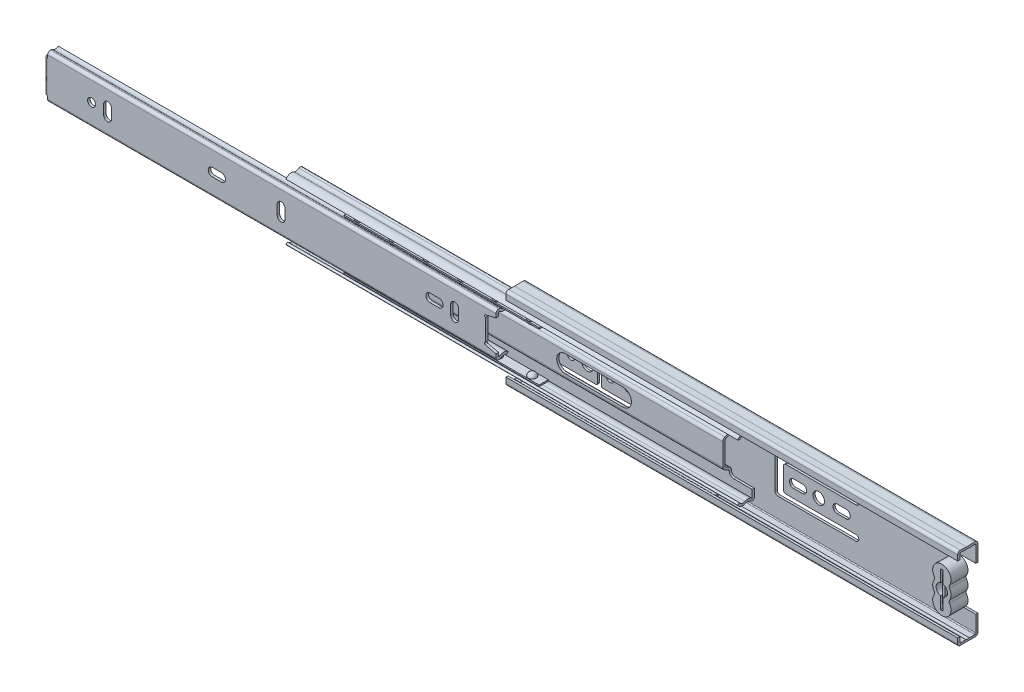
from build123d import *
from build123d.topology import SkipClean

# Parameters (mm, degrees)
EXTRUDE1_DEPTH      = 124.968
MIDDLE_MEMBER_DEPTH = 249.936
DRAWER_START        = -249.936
DRAWER_MEMBER_DEPTH = 249.936
SKETCH6_W           = 1.905
SKETCH6_H           = 12.147486483
CUT_EXTRUDE1_DEPTH  = 380.866876503
EXTRUDE4_DEPTH      = 8.89
CUT_EXTRUDE2_DEPTH  = 1.1938
SKETCH9_W           = 1.397
SKETCH9_H           = 7.493000005
EXTRUDE5_DEPTH      = 8.89
EXTRUDE6_DEPTH      = 1.016
EXTRUDE6_DEPTH_BACK = 8.382
CUT_EXTRUDE3_DEPTH  = 1.397
CUT_EXTRUDE4_DEPTH  = 380.716914371
CUT_EXTRUDE5_DEPTH  = 1.1938
CUT_EXTRUDE14_DEPTH = 1.1938
CUT_EXTRUDE15_DEPTH = 1.1938
SKETCH24_R          = 2.1844
CUT_EXTRUDE13_DEPTH = 1.397
CUT_E_DEPTH         = 1.397
CUT_EXTRUDE17_DEPTH = 1.2192
LPATTERN1_COUNT     = 6
LPATTERN1_PITCH     = 19.05
EXTRUDE7_DEPTH      = 6.35
EXTRUDE7_DEPTH_BACK = 101.6
SKETCH28_W          = 7.62
SKETCH28_H          = 0.762
LPATTERN2_COUNT     = 6
LPATTERN2_PITCH     = 19.05
EXTRUDE8_DEPTH      = 6.35
EXTRUDE8_DEPTH_BACK = 101.6
SKETCH30_W          = 5.08
SKETCH30_H          = 0.762


# Read off the part's stored shape, not the designer's step: Drawer Member
with BuildPart() as part:
    # Sketch1 → Extrude1 (new, symmetric)
    with BuildSketch(Plane(origin=(0, 0, 0), x_dir=(0, 0, -1), z_dir=(1, 0, 0))):
        with BuildLine():
            Line((-4.139279899, 22.8203125), (-0.743323143, 22.698920454))
            Line((-0.743323143, 22.698920454), (3.892452069, 22.8203125))
            ThreePointArc((3.892452069, 22.8203125), (5.124499805, 22.338098312), (5.6388, 21.119095664))
            Line((5.6388, 21.119095664), (5.6388, 0))
            Line((5.6388, 0), (4.445, 0))
            Line((4.445, 0), (4.445, 21.119095664))
            ThreePointArc((4.445, 21.119095664), (4.291477554, 21.482977052), (3.92370211, 21.626921585))
            Line((3.92370211, 21.626921585), (0.761857041, 21.544125758))
            ThreePointArc((0.761857041, 21.544125758), (-0.187154328, 21.71413397), (-1.131158407, 21.51822157))
            Line((-1.131158407, 21.51822157), (-4.181926298, 21.627274477))
            ThreePointArc((-4.181926298, 21.627274477), (-4.367367911, 21.55622161), (-4.445, 21.3734366))
            Line((-4.445, 21.3734366), (-4.445, 18.415))
            Line((-4.445, 18.415), (-5.6388, 18.415))
            Line((-5.6388, 18.415), (-5.6388, 21.3734366))
            ThreePointArc((-5.6388, 21.3734366), (-5.19629709, 22.415311161), (-4.139279899, 22.8203125))
        make_face()
    extrude(amount=EXTRUDE1_DEPTH, both=True)

    # Sketch8 → Cut-Extrude2 (cut)
    with BuildSketch(Plane.XY.offset(-4.445)):
        with BuildLine():
            Line((115.329533997, 7.645578895), (116.7638, 7.493000005))
            Line((116.7638, 7.493000005), (116.7638, 0))
            Line((116.7638, 0), (124.968, 0))
            Line((124.968, 0), (124.968, 12.204752384))
            Line((124.968, 12.204752384), (115.571356843, 12.204752384))
            ThreePointArc((115.571356843, 12.204752384), (113.288565723, 10.03983377), (115.329533997, 7.645578895))
        make_face()
    extrude(amount=-CUT_EXTRUDE2_DEPTH, mode=Mode.SUBTRACT)

    # Sketch9 → Extrude5 (add)
    with BuildSketch(Plane.XY.offset(-4.445)):
        with Locations((116.0653, 3.746500003)):
            Rectangle(SKETCH9_W, SKETCH9_H)
    extrude(amount=EXTRUDE5_DEPTH)

    # Sketch13 → Cut-Extrude5 (cut)
    with BuildSketch(Plane.XY.offset(-4.445)):
        with BuildLine():
            Line((-56.579699917, 7.112000069), (-81.408199931, 7.112000069))
            ThreePointArc((-81.408199931, 7.112000069), (-81.947015347, 6.888815416), (-82.1702, 6.35))
            Line((-82.1702, 6.35), (-82.1702, 0))
            Line((-82.1702, 0), (-84.4562, 0))
            Line((-84.4562, 0), (-84.4562, 6.35))
            ThreePointArc((-84.4562, 6.35), (-84.679384653, 6.888815416), (-85.218200069, 7.112000069))
            Line((-85.218200069, 7.112000069), (-107.506699917, 7.112000069))
            ThreePointArc((-107.506699917, 7.112000069), (-109.094199917, 8.699500069), (-107.506699917, 10.287000069))
            Line((-107.506699917, 10.287000069), (-56.579699917, 10.287000069))
            ThreePointArc((-56.579699917, 10.287000069), (-54.992199917, 8.699500069), (-56.579699917, 7.112000069))
        make_face()
        with BuildLine():
            Line((-62.193099917, 2.286), (-67.146099917, 2.286))
            ThreePointArc((-67.146099917, 2.286), (-68.762546018, 1.616446102), (-69.432099917, 0))
            Line((-69.432099917, 0), (-59.907099917, 0))
            ThreePointArc((-59.907099917, 0), (-60.576653815, 1.616446102), (-62.193099917, 2.286))
        make_face()
        with BuildLine():
            Line((-101.245599917, 0), (-96.673599917, 0))
            ThreePointArc((-96.673599917, 0), (-98.959599917, 2.286), (-101.245599917, 0))
        make_face()
        with BuildLine():
            Line((-93.143000083, 0), (-86.792999917, 0))
            ThreePointArc((-86.792999917, 0), (-89.968, 3.175000083), (-93.143000083, 0))
        make_face()
        with BuildLine():
            Line((-79.655599917, 0), (-75.083599917, 0))
            ThreePointArc((-75.083599917, 0), (-77.369599917, 2.286), (-79.655599917, 0))
        make_face()
    extrude(amount=-CUT_EXTRUDE5_DEPTH, mode=Mode.SUBTRACT)

    # Sketch32 → Cut-Extrude14 (cut)
    with BuildSketch(Plane(origin=(0, 0, -5.6388), x_dir=(-1, 0, 0), z_dir=(0, 0, -1))):
        with BuildLine():
            Line((-55.4945, 0), (-45.9695, 0))
            ThreePointArc((-45.9695, 0), (-46.639053898, 1.616446102), (-48.2555, 2.286))
            Line((-48.2555, 2.286), (-53.2085, 2.286))
            ThreePointArc((-53.2085, 2.286), (-54.824946102, 1.616446102), (-55.4945, 0))
        make_face()
        with BuildLine():
            Line((-41.207, 0), (-34.857, 0))
            ThreePointArc((-34.857, 0), (-38.032, 3.175), (-41.207, 0))
        make_face()
        with BuildLine():
            Line((-31.3645, 0), (-21.8395, 0))
            ThreePointArc((-21.8395, 0), (-22.509053898, 1.616446102), (-24.1255, 2.286))
            Line((-24.1255, 2.286), (-29.0785, 2.286))
            ThreePointArc((-29.0785, 2.286), (-30.694946102, 1.616446102), (-31.3645, 0))
        make_face()
        with BuildLine():
            Line((-18.474, 0), (-13.902, 0))
            Line((-13.902, 0), (-13.902, 8.763000069))
            ThreePointArc((-13.902, 8.763000069), (-14.348369265, 9.840630803), (-15.426, 10.287000069))
            Line((-15.426, 10.287000069), (-58.6695, 10.287000069))
            ThreePointArc((-58.6695, 10.287000069), (-60.257, 8.699500069), (-58.6695, 7.112000069))
            Line((-58.6695, 7.112000069), (-19.998, 7.112000069))
            ThreePointArc((-19.998, 7.112000069), (-18.920369265, 6.665630803), (-18.474, 5.588000069))
            Line((-18.474, 5.588000069), (-18.474, 0))
        make_face()
    extrude(amount=-CUT_EXTRUDE14_DEPTH, mode=Mode.SUBTRACT)

    # Sketch31 → Cut-Extrude15 (cut)
    with BuildSketch(Plane(origin=(0, 0, -5.6388), x_dir=(-1, 0, 0), z_dir=(0, 0, -1))):
        with BuildLine():
            Line((-109.093, 0), (-102.743, 0))
            ThreePointArc((-102.743, 0), (-105.918, 3.175), (-109.093, 0))
        make_face()
    extrude(amount=-CUT_EXTRUDE15_DEPTH, mode=Mode.SUBTRACT)

    # Mirror3 4: part across plane


with BuildPart() as body_2:
    # Sketch2 → Middle Member (new body)
    with BuildSketch(Plane.ZY.offset(246.6101875)):
        with BuildLine():
            ThreePointArc((5.7404, 15.627692517), (3.735864231, 17.127444277), (1.241474216, 16.914283663))
            ThreePointArc((1.241474216, 16.914283663), (-0.188944013, 16.688900955), (-1.505642365, 17.291560999))
            ThreePointArc((-1.505642365, 17.291560999), (-2.813430342, 17.487614783), (-3.53059999, 16.376572852))
            Line((-3.53059999, 16.376572852), (-3.53059999, 9.521737984))
            ThreePointArc((-3.53059999, 9.521737984), (-3.220327109, 8.457239952), (-2.386691239, 7.726160915))
            Line((-2.386691239, 7.726160915), (-0.414564934, 6.806543316))
            ThreePointArc((-0.414564934, 6.806543316), (-0.093935732, 6.525359052), (0.0254, 6.115936705))
            Line((0.0254, 6.115936705), (0.0254, 0))
            Line((0.0254, 0), (1.2446, 0))
            Line((1.2446, 0), (1.2446, 6.115936705))
            ThreePointArc((1.2446, 6.115936705), (0.934327119, 7.180434735), (0.100691251, 7.91151377))
            Line((0.100691251, 7.91151377), (-1.871435054, 8.831131369))
            ThreePointArc((-1.871435054, 8.831131369), (-2.192064258, 9.112315634), (-2.31139999, 9.521737984))
            Line((-2.31139999, 9.521737984), (-2.31139999, 16.376572852))
            ThreePointArc((-2.31139999, 16.376572852), (-2.311399987, 16.376572856), (-2.311399982, 16.376572855))
            ThreePointArc((-2.311399982, 16.376572855), (-0.35482671, 15.481038557), (1.770730805, 15.815950333))
            ThreePointArc((1.770730805, 15.815950333), (3.400639083, 15.955235789), (4.710462095, 14.975253591))
            Line((4.710462095, 14.975253591), (5.7404, 15.627692517))
        make_face()
    extrude(amount=-MIDDLE_MEMBER_DEPTH)

    # Sketch12 → Cut-Extrude4 (cut, through all)
    with BuildSketch(Plane.XY.offset(1.2446)):
        with BuildLine():
            Line((3.3258125, 12.065), (-6.8341875, 12.065))
            ThreePointArc((-6.8341875, 12.065), (-8.630238724, 11.321051224), (-9.3741875, 9.525))
            Line((-9.3741875, 9.525), (-9.3741875, 0))
            Line((-9.3741875, 0), (3.3258125, 0))
            Line((3.3258125, 0), (3.3258125, 12.065))
        make_face()
    extrude(amount=-CUT_EXTRUDE4_DEPTH, mode=Mode.SUBTRACT)

    # Sketch26 → Cut-Extrude17 (cut)
    with BuildSketch(Plane.XY.offset(1.2446)):
        with BuildLine():
            Line((-101.245599917, 0), (-59.907099917, 0))
            ThreePointArc((-59.907099917, 0), (-61.320602591, 3.412497326), (-64.733099917, 4.826))
            Line((-64.733099917, 4.826), (-96.419599917, 4.826))
            ThreePointArc((-96.419599917, 4.826), (-99.832097243, 3.412497326), (-101.245599917, 0))
        make_face()
        with BuildLine():
            Line((55.4945, 0), (21.8395, 0))
            ThreePointArc((21.8395, 0), (23.253002674, 3.412497326), (26.6655, 4.826))
            Line((26.6655, 4.826), (50.6685, 4.826))
            ThreePointArc((50.6685, 4.826), (54.080997326, 3.412497326), (55.4945, 0))
        make_face()
    extrude(amount=-CUT_EXTRUDE17_DEPTH, mode=Mode.SUBTRACT)

    # Mirror3 3: body 2 across plane


with BuildPart() as body_3:
    # Drawer Member outline → Drawer Member (new body)
    with BuildSketch(Plane.ZY.offset(378.968).offset(DRAWER_START)):
        with BuildLine():
            Line((5.6642, 0), (7.0612, 0))
            Line((7.0612, 0), (7.0612, 10.623486483))
            ThreePointArc((7.0612, 10.623486483), (6.614830734, 11.701117218), (5.5372, 12.147486483))
            Line((5.5372, 12.147486483), (5.164341455, 12.147486483))
            ThreePointArc((5.164341455, 12.147486483), (4.67440708, 12.066587417), (4.236487447, 11.83247901))
            ThreePointArc((4.236487447, 11.83247901), (2.709144677, 11.334862777), (1.208194452, 11.907179363))
            Line((1.208194452, 11.907179363), (0.304054167, 10.842219578))
            ThreePointArc((0.304054167, 10.842219578), (2.674694689, 9.938287609), (5.087020295, 10.724235863))
            ThreePointArc((5.087020295, 10.724235863), (5.123513594, 10.743744895), (5.164341455, 10.750486483))
            Line((5.164341455, 10.750486483), (5.5372, 10.750486483))
            ThreePointArc((5.5372, 10.750486483), (5.627002561, 10.713289044), (5.6642, 10.623486483))
            Line((5.6642, 10.623486483), (5.6642, 0))
        make_face()
    extrude(amount=DRAWER_MEMBER_DEPTH)

    # Sketch6 → Cut-Extrude1 (cut, through all)
    with BuildSketch(Plane.XY.offset(7.0612)):
        with Locations((-378.0155, 6.073743242)):
            Rectangle(SKETCH6_W, SKETCH6_H)
    extrude(amount=-CUT_EXTRUDE1_DEPTH, mode=Mode.SUBTRACT)

    # Sketch7 → Extrude4 (add)
    with BuildSketch(Plane.XZ):
        with BuildLine():
            Line((-377.063, 7.0612), (-377.317, 7.0612))
            ThreePointArc((-377.317, 7.0612), (-378.484433296, 6.577633296), (-378.968, 5.4102))
            Line((-378.968, 5.4102), (-378.968, 0.304054167))
            Line((-378.968, 0.304054167), (-377.571, 0.304054167))
            Line((-377.571, 0.304054167), (-377.571, 5.4102))
            ThreePointArc((-377.571, 5.4102), (-377.496605122, 5.589805122), (-377.317, 5.6642))
            Line((-377.317, 5.6642), (-377.063, 5.6642))
            Line((-377.063, 5.6642), (-377.063, 7.0612))
        make_face()
    extrude(amount=-EXTRUDE4_DEPTH)

    # Sketch11 → Cut-Extrude3 (cut)
    with BuildSketch(Plane.XY.offset(7.0612)):
        with BuildLine():
            Line((-134.746951398, 5.967847879), (-134.747, 0))
            Line((-134.747, 0), (-129.032, 0))
            Line((-129.032, 0), (-129.032, 8.589285844))
            Line((-129.032, 8.589285844), (-134.891326457, 7.221216084))
            ThreePointArc((-134.891326457, 7.221216084), (-135.377774848, 6.530182899), (-134.746951398, 5.967847879))
        make_face()
    extrude(amount=-CUT_EXTRUDE3_DEPTH, mode=Mode.SUBTRACT)

    # Sketch24 → Cut-Extrude13 (cut)
    with BuildSketch(Plane.XY.offset(7.0612)):
        with Locations((-352.806, 0)):
            Circle(SKETCH24_R)
        with BuildLine():
            Line((-346.1004, 2.6416), (-346.1004, 0))
            Line((-346.1004, 0), (-341.7316, 0))
            Line((-341.7316, 0), (-341.7316, 2.6416))
            ThreePointArc((-341.7316, 2.6416), (-343.916, 4.826), (-346.1004, 2.6416))
        make_face()
        with BuildLine():
            Line((-288.2265, 0), (-278.7015, 0))
            ThreePointArc((-278.7015, 0), (-279.371053898, 1.616446102), (-280.9875, 2.286))
            Line((-280.9875, 2.286), (-285.9405, 2.286))
            ThreePointArc((-285.9405, 2.286), (-287.556946102, 1.616446102), (-288.2265, 0))
        make_face()
        with BuildLine():
            Line((-250.0884, 2.6416), (-250.0884, 0))
            Line((-250.0884, 0), (-245.7196, 0))
            Line((-245.7196, 0), (-245.7196, 2.6416))
            ThreePointArc((-245.7196, 2.6416), (-247.904, 4.826), (-250.0884, 2.6416))
        make_face()
    extrude(amount=-CUT_EXTRUDE13_DEPTH, mode=Mode.SUBTRACT)

    # Sketch25 → Cut E (cut)
    with BuildSketch(Plane.XY.offset(7.0612)):
        with BuildLine():
            Line((-154.0764, 0), (-149.7076, 0))
            Line((-149.7076, 0), (-149.7076, 2.6416))
            ThreePointArc((-149.7076, 2.6416), (-151.892, 4.826), (-154.0764, 2.6416))
            Line((-154.0764, 2.6416), (-154.0764, 0))
        make_face()
        with BuildLine():
            Line((-158.3055, 0), (-167.8305, 0))
            ThreePointArc((-167.8305, 0), (-167.160946102, 1.616446102), (-165.5445, 2.286))
            Line((-165.5445, 2.286), (-160.5915, 2.286))
            ThreePointArc((-160.5915, 2.286), (-158.975053898, 1.616446102), (-158.3055, 0))
        make_face()
    extrude(amount=-CUT_E_DEPTH, mode=Mode.SUBTRACT)

    # Mirror3 2: body 3 across plane


with BuildPart() as body_4:
    # Sketch10 → Extrude6 (new, two sides: drawn at the far end of the back side and taken through both)
    with BuildSketch(Plane.XY.offset(4.445).offset(-EXTRUDE6_DEPTH_BACK)):
        with BuildLine():
            Line((110.9853, 0), (112.8903, 0))
            ThreePointArc((112.8903, 0), (113.58046946, 1.976421561), (115.350925, 3.093589074))
            Line((115.350925, 3.093589074), (115.350925, 9.8425))
            Line((115.350925, 9.8425), (116.779675, 9.8425))
            Line((116.779675, 9.8425), (116.779675, 3.093589074))
            ThreePointArc((116.779675, 3.093589074), (118.55013054, 1.976421561), (119.2403, 0))
            Line((119.2403, 0), (121.1453, 0))
            ThreePointArc((121.1453, 0), (120.938650432, 1.434174174), (120.335514345, 2.751666667))
            ThreePointArc((120.335514345, 2.751666667), (120.082456328, 3.6115625), (120.335514345, 4.471458333))
            ThreePointArc((120.335514345, 4.471458333), (116.0653, 12.303125), (111.795085655, 4.471458333))
            ThreePointArc((111.795085655, 4.471458333), (112.048143672, 3.6115625), (111.795085655, 2.751666667))
            ThreePointArc((111.795085655, 2.751666667), (111.191949568, 1.434174174), (110.9853, 0))
        make_face()
    extrude(amount=EXTRUDE6_DEPTH + EXTRUDE6_DEPTH_BACK)

    # Mirror3: body 4 across plane


with BuildPart() as body_5:
    # Sketch27 → Revolve1 (revolve)
    with BuildSketch(Plane.ZY.offset(112.268)):
        with BuildLine():
            Line((0.1524, 21.683172421), (0.1524, 16.665571078))
            ThreePointArc((0.1524, 16.665571078), (2.661200671, 19.174371749), (0.1524, 21.683172421))
        make_face()
    revolve(axis=Axis((-112.268, 23.635004298, 0.1524), (0, -1, 0)))


with BuildPart() as lpattern1_1:
    # LPattern1: pattern copy
    add(body_5.part.moved(Location(Vector(1, 0, 0) * (1 * LPATTERN1_PITCH))))


with BuildPart() as lpattern1_2:
    # LPattern1: pattern copy
    add(body_5.part.moved(Location(Vector(1, 0, 0) * (2 * LPATTERN1_PITCH))))


with BuildPart() as lpattern1_3:
    # LPattern1: pattern copy
    add(body_5.part.moved(Location(Vector(1, 0, 0) * (3 * LPATTERN1_PITCH))))


with BuildPart() as lpattern1_4:
    # LPattern1: pattern copy
    add(body_5.part.moved(Location(Vector(1, 0, 0) * (4 * LPATTERN1_PITCH))))


with BuildPart() as lpattern1_5:
    # LPattern1: pattern copy
    add(body_5.part.moved(Location(Vector(1, 0, 0) * (5 * LPATTERN1_PITCH))))


with BuildPart() as body_5_1:
    add(body_5.part)

    add(lpattern1_1.part)  # Extrude7 merges LPattern1_1

    add(lpattern1_2.part)  # Extrude7 merges LPattern1_2

    add(lpattern1_3.part)  # Extrude7 merges LPattern1_3

    add(lpattern1_4.part)  # Extrude7 merges LPattern1_4

    add(lpattern1_5.part)  # Extrude7 merges LPattern1_5
    # Sketch28 → Extrude7 (add, two sides: drawn at the far end of the back side and taken through both)
    with BuildSketch(Plane.ZY.offset(112.268).offset(-EXTRUDE7_DEPTH_BACK)):
        with Locations((0.1524, 19.174371749)):
            Rectangle(SKETCH28_W, SKETCH28_H)
    extrude(amount=EXTRUDE7_DEPTH + EXTRUDE7_DEPTH_BACK)


with BuildPart() as body_6:
    # Sketch29 → Revolve2 (revolve)
    with BuildSketch(Plane.ZY.offset(208.5101875)):
        with BuildLine():
            Line((2.7686, 16.043834368), (2.7686, 11.446434358))
            ThreePointArc((2.7686, 11.446434358), (5.067300005, 13.745134363), (2.7686, 16.043834368))
        make_face()
    revolve(axis=Axis((-208.5101875, 16.680143034, 2.7686), (0, -1, 0)))


with BuildPart() as lpattern2_1:
    # LPattern2: pattern copy
    add(body_6.part.moved(Location(Vector(1, 0, 0) * (1 * LPATTERN2_PITCH))))


with BuildPart() as lpattern2_2:
    # LPattern2: pattern copy
    add(body_6.part.moved(Location(Vector(1, 0, 0) * (2 * LPATTERN2_PITCH))))


with BuildPart() as lpattern2_3:
    # LPattern2: pattern copy
    add(body_6.part.moved(Location(Vector(1, 0, 0) * (3 * LPATTERN2_PITCH))))


with BuildPart() as lpattern2_4:
    # LPattern2: pattern copy
    add(body_6.part.moved(Location(Vector(1, 0, 0) * (4 * LPATTERN2_PITCH))))


with BuildPart() as lpattern2_5:
    # LPattern2: pattern copy
    add(body_6.part.moved(Location(Vector(1, 0, 0) * (5 * LPATTERN2_PITCH))))


with BuildPart() as body_6_1:
    add(body_6.part)

    add(lpattern2_1.part)  # Extrude8 merges LPattern2_1

    add(lpattern2_2.part)  # Extrude8 merges LPattern2_2

    add(lpattern2_3.part)  # Extrude8 merges LPattern2_3

    add(lpattern2_4.part)  # Extrude8 merges LPattern2_4

    add(lpattern2_5.part)  # Extrude8 merges LPattern2_5
    # Sketch30 → Extrude8 (add, two sides: drawn at the far end of the back side and taken through both)
    with BuildSketch(Plane.ZY.offset(208.5101875).offset(-EXTRUDE8_DEPTH_BACK)):
        with Locations((2.7686, 13.745134363)):
            Rectangle(SKETCH30_W, SKETCH30_H)
    extrude(amount=EXTRUDE8_DEPTH + EXTRUDE8_DEPTH_BACK)


with BuildPart() as body_4_1:
    add(body_4.part)
    add(body_4.part.mirror(Plane.ZX))


with BuildPart() as body_3_1:
    with SkipClean():  # the faces are left unmerged after this step: merging them gives an invalid solid
        add(body_3.part)
        add(body_3.part.mirror(Plane.ZX))


with BuildPart() as body_2_1:
    add(body_2.part)
    add(body_2.part.mirror(Plane.ZX))


with BuildPart() as part_1:
    with SkipClean():  # the faces are left unmerged after this step: merging them gives an invalid solid
        add(part.part)
        add(part.part.mirror(Plane.ZX))


with BuildPart() as body_7:
    # Mirror5: mirrored copy
    add(body_6_1.part.mirror(Plane.ZX))


with BuildPart() as body_8:
    # Mirror5 2: mirrored copy
    add(body_5_1.part.mirror(Plane.ZX))


solid = Compound([body_5_1.part, body_6_1.part, body_4_1.part, body_3_1.part, body_2_1.part, part_1.part, body_7.part, body_8.part])
